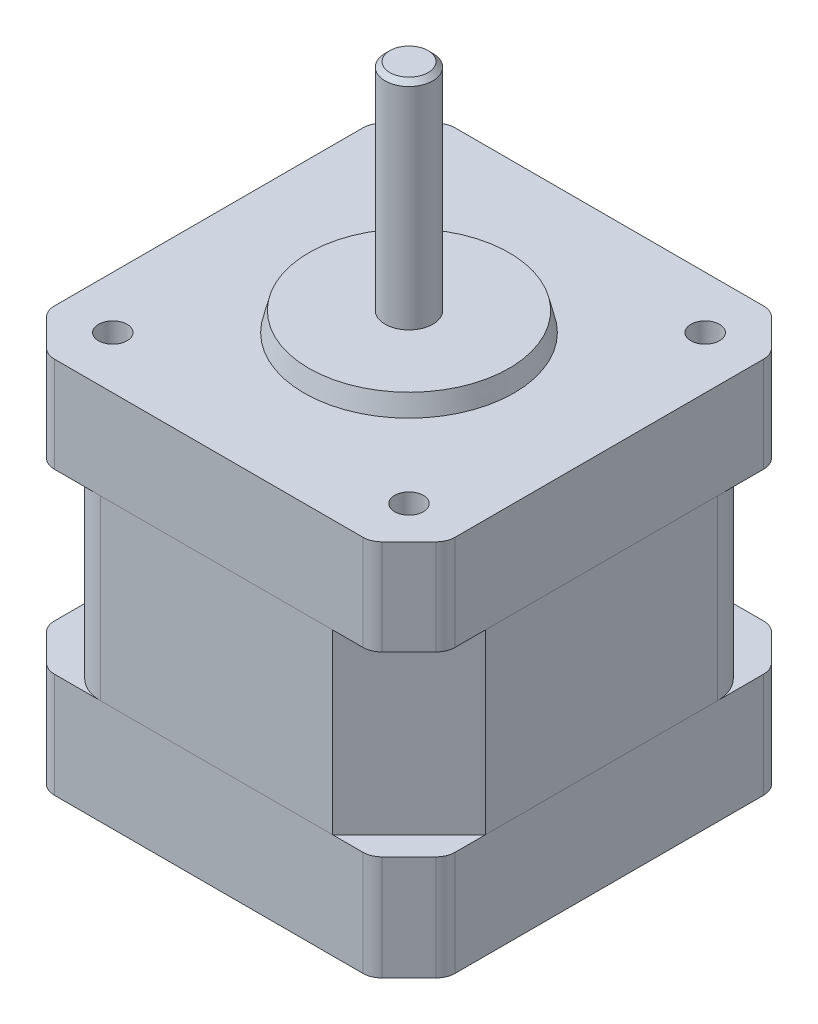
from build123d import *

# Parameters (mm, degrees)
SKETCH1_W           = 42
SKETCH1_H           = 42
BOSS_EXTRUDE1_DEPTH = 10
SKETCH2_R           = 11
BOSS_EXTRUDE2_DEPTH = 2
SKETCH3_R           = 2.5
BOSS_EXTRUDE3_DEPTH = 22.6
CHAMFER2_SIZE       = 0.5
CHAMFER3_SIZE2      = 2
CHAMFER3_SIZE       = 0.5
SKETCH1_4_W         = 42
SKETCH1_4_H         = 42
BOSS_EXTRUDE6_DEPTH = 18.6
SKETCH6_W           = 42
SKETCH6_H           = 42
BOSS_EXTRUDE7_DEPTH = 11
CHAMFER5_SIZE       = 4
CHAMFER6_SIZE       = 4
FILLET2_R           = 2
FILLET3_R           = 2
SKETCH7_W           = 8
SKETCH7_H           = 7
BOSS_EXTRUDE8_DEPTH = 0.5
CHAMFER7_SIZE       = 8
FILLET4_R           = 4
SKETCH8_R           = 1.5
CUT_EXTRUDE2_DEPTH  = 15


with BuildPart() as part:
    # Sketch1 → Boss-Extrude1 (new body)
    with BuildSketch(Plane(origin=(0, 0, 0), x_dir=(1, 0, 0), z_dir=(0, 1, 0))):
        Rectangle(SKETCH1_W, SKETCH1_H)
    extrude(amount=BOSS_EXTRUDE1_DEPTH)

    # Sketch2 → Boss-Extrude2 (add)
    with BuildSketch(Plane(origin=(0, 10, 0), x_dir=(1, 0, 0), z_dir=(0, 1, 0))):
        with Locations(Location((0, 0, 0), (0, 0, 270))):
            Circle(SKETCH2_R)
    extrude(amount=BOSS_EXTRUDE2_DEPTH)

    # Sketch3 → Boss-Extrude3 (add)
    with BuildSketch(Plane(origin=(0, 12, 0), x_dir=(1, 0, 0), z_dir=(0, 1, 0))):
        with Locations(Location((0, 0, 0), (0, 0, 270))):
            Circle(SKETCH3_R)
    extrude(amount=BOSS_EXTRUDE3_DEPTH)

    # Chamfer2
    chamfer2_edges = [part.edges().sort_by_distance(p)[0] for p in [
        (0, 34.6, -2.5),
    ]]
    chamfer(chamfer2_edges, length=CHAMFER2_SIZE)

    # Chamfer3
    chamfer3_edges = [part.edges().sort_by_distance(p)[0] for p in [
        (0, 12, -11),
    ]]
    chamfer3_side = [part.faces().sort_by_distance(p)[0] for p in [
        (0, 12, -10.99),
    ]]
    chamfer(chamfer3_edges, length=CHAMFER3_SIZE - 0.0001, length2=CHAMFER3_SIZE2 - 0.0001, reference=chamfer3_side[0])  # a hair under: the kernel refuses the full size

    # Chamfer5
    chamfer5_edges = [part.edges().sort_by_distance(p)[0] for p in [
        (-21, 5, -21),
        (21, 5, -21),
        (21, 5, 21),
        (-21, 5, 21),
    ]]
    chamfer(chamfer5_edges, length=CHAMFER5_SIZE)

    # Fillet2
    fillet2_edges = [part.edges().sort_by_distance(p)[0] for p in [
        (21, 5, -17),
        (21, 5, 17),
        (-17, 5, 21),
        (17, 5, 21),
        (-17, 5, -21),
        (17, 5, -21),
        (-21, 5, -17),
        (-21, 5, 17),
    ]]
    fillet(fillet2_edges, radius=FILLET2_R)


with BuildPart() as body_2:
    # Sketch1<4> → Boss-Extrude6 (new body)
    with BuildSketch(Plane(origin=(0, 0, 0), x_dir=(1, 0, 0), z_dir=(0, 1, 0))):
        Rectangle(SKETCH1_4_W, SKETCH1_4_H)
    extrude(amount=-BOSS_EXTRUDE6_DEPTH)

    # Chamfer7
    chamfer7_edges = [body_2.edges().sort_by_distance(p)[0] for p in [
        (-21, -9.3, -21),
        (21, -9.3, -21),
        (21, -9.3, 21),
        (-21, -9.3, 21),
    ]]
    chamfer(chamfer7_edges, length=CHAMFER7_SIZE)

    # Fillet4
    fillet4_edges = [body_2.edges().sort_by_distance(p)[0] for p in [
        (13, -9.3, -21),
        (-13, -9.3, -21),
        (-21, -9.3, 13),
        (-21, -9.3, -13),
        (-13, -9.3, 21),
        (21, -9.3, -13),
    ]]
    fillet(fillet4_edges, radius=FILLET4_R)


with BuildPart() as body_3:
    # Sketch6 → Boss-Extrude7 (new body)
    with BuildSketch(Plane.XZ.offset(18.6)):
        Rectangle(SKETCH6_W, SKETCH6_H)
    extrude(amount=BOSS_EXTRUDE7_DEPTH)

    # Chamfer6
    chamfer6_edges = [body_3.edges().sort_by_distance(p)[0] for p in [
        (-21, -24.1, 21),
        (21, -24.1, 21),
        (21, -24.1, -21),
        (-21, -24.1, -21),
    ]]
    chamfer(chamfer6_edges, length=CHAMFER6_SIZE)

    # Fillet3
    fillet3_edges = [body_3.edges().sort_by_distance(p)[0] for p in [
        (21, -24.1, 17),
        (21, -24.1, -17),
        (-17, -24.1, -21),
        (17, -24.1, -21),
        (-21, -24.1, 17),
        (-21, -24.1, -17),
        (17, -24.1, 21),
        (-17, -24.1, 21),
    ]]
    fillet(fillet3_edges, radius=FILLET3_R)

    # Sketch7 → Boss-Extrude8 (add)
    with BuildSketch(Plane(origin=(0, 0, -21), x_dir=(-1, 0, 0), z_dir=(0, 0, -1))):
        with Locations((0, -23.6)):
            Rectangle(SKETCH7_W, SKETCH7_H)
    extrude(amount=BOSS_EXTRUDE8_DEPTH)


with BuildPart() as cut_extrude2_tool:
    # Sketch8 → Cut-Extrude2 (new body)
    with BuildSketch(Plane(origin=(0, 10, 0), x_dir=(1, 0, 0), z_dir=(0, 1, 0))):
        with Locations(Location((-15.525, 15.525, 0), (0, 0, 270))):
            Circle(SKETCH8_R)
        with Locations(Location((15.525, 15.525, 0), (0, 0, 270))):
            Circle(SKETCH8_R)
        with Locations(Location((15.525, -15.525, 0), (0, 0, 270))):
            Circle(SKETCH8_R)
        with Locations(Location((-15.525, -15.525, 0), (0, 0, 270))):
            Circle(SKETCH8_R)
    extrude(amount=-CUT_EXTRUDE2_DEPTH)


with BuildPart() as part_1:
    add(part.part)

    # Cut-Extrude2: cut by cut_extrude2_tool
    add(cut_extrude2_tool.part, mode=Mode.SUBTRACT)


with BuildPart() as body_2_1:
    add(body_2.part)

    # Cut-Extrude2: cut by cut_extrude2_tool
    add(cut_extrude2_tool.part, mode=Mode.SUBTRACT)


solid = Compound([body_3.part, part_1.part, body_2_1.part])
